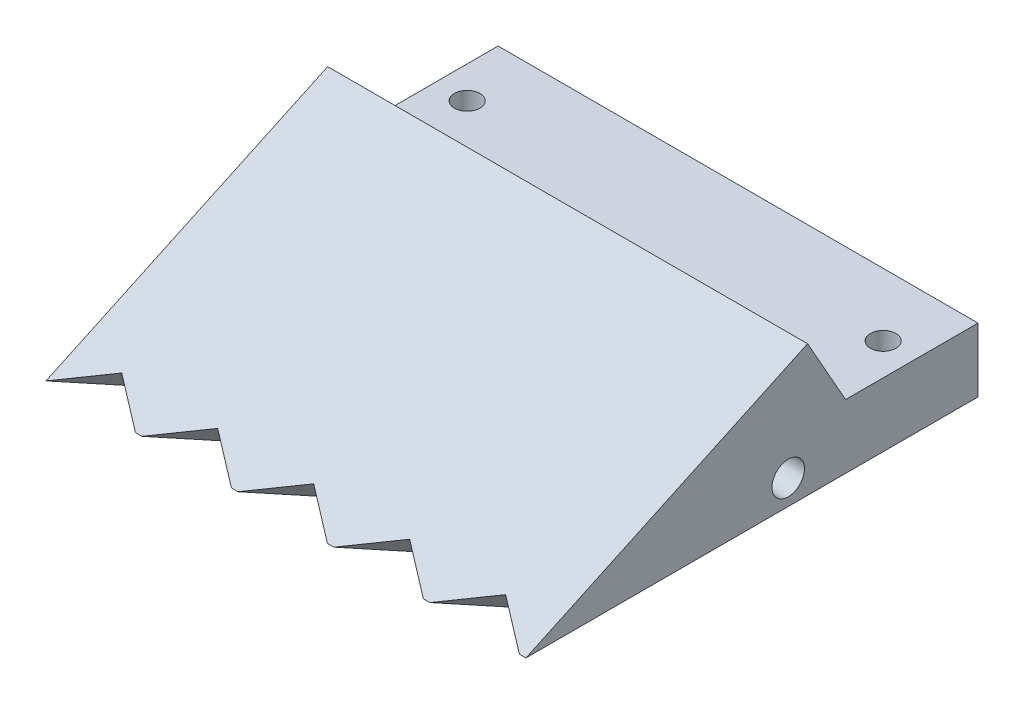
from build123d import *

# Parameters (mm, degrees)
BOSS_EXTRUDE1_DEPTH = 75
SKETCH2_R           = 2
CUT_EXTRUDE1_DEPTH  = 10
CUT_EXTRUDE2_DEPTH  = 10
SKETCH3_R           = 2.543008444
CUT_EXTRUDE3_DEPTH  = 100
CHAMFER1_SIZE       = 2


with BuildPart() as part:
    # Sketch1 → Boss-Extrude1 (new body)
    with BuildSketch(Plane(origin=(0, 0, 0), x_dir=(0, 0, -1), z_dir=(1, 0, 0))):
        Polygon((-35.447605249, 4.173188871), (35.206481481, 4.173188871), (35.206481481, 14.173188871), (14.511910864, 14.173188871), (8.571096195, 24.699446456), align=None)
    extrude(amount=BOSS_EXTRUDE1_DEPTH)

    # Sketch2 → Cut-Extrude1 (cut)
    with BuildSketch(Plane(origin=(0, 14.173188871, 0), x_dir=(1, 0, 0), z_dir=(0, 1, 0))):
        with Locations((5, 25.374559272)):
            Circle(SKETCH2_R)
        with Locations((69.999998955, 25.38621548)):
            Circle(SKETCH2_R)
    extrude(amount=-CUT_EXTRUDE1_DEPTH, mode=Mode.SUBTRACT)

    # Sketch4 → Cut-Extrude2 (cut)
    with BuildSketch(Plane(origin=(0, 17.005051997, 7.929585973), x_dir=(1, 0, 0), z_dir=(0, 0.9063077870366527, 0.4226182617406937))):
        Polygon((0, -30.362774842), (7.065850082, -25.103103439), (13.976560291, -30.362774842), align=None)
        Polygon((22.065850082, -25.103103439), (28.976560291, -30.362774842), (15, -30.362774842), align=None)
        Polygon((37.065850082, -25.103103439), (43.976560291, -30.362774842), (30, -30.362774842), align=None)
        Polygon((52.065850082, -25.103103439), (58.976560291, -30.362774842), (45, -30.362774842), align=None)
        Polygon((67.065850082, -25.103103439), (73.976560291, -30.362774842), (60, -30.362774842), align=None)
    extrude(amount=-CUT_EXTRUDE2_DEPTH, mode=Mode.SUBTRACT)

    # Sketch3 → Cut-Extrude3 (cut)
    with BuildSketch(Plane.ZY):
        with Locations((-5.547587106, 8.033515635)):
            Circle(SKETCH3_R)
    extrude(amount=-CUT_EXTRUDE3_DEPTH, mode=Mode.SUBTRACT)

    # Chamfer1
    chamfer1_edges = [part.edges().sort_by_distance(p)[0] for p in [
        (67.999998955, 4.173188871, -25.38621548),
        (3, 4.173188871, -25.374559272),
    ]]
    chamfer(chamfer1_edges, length=CHAMFER1_SIZE)


solid = part.part
